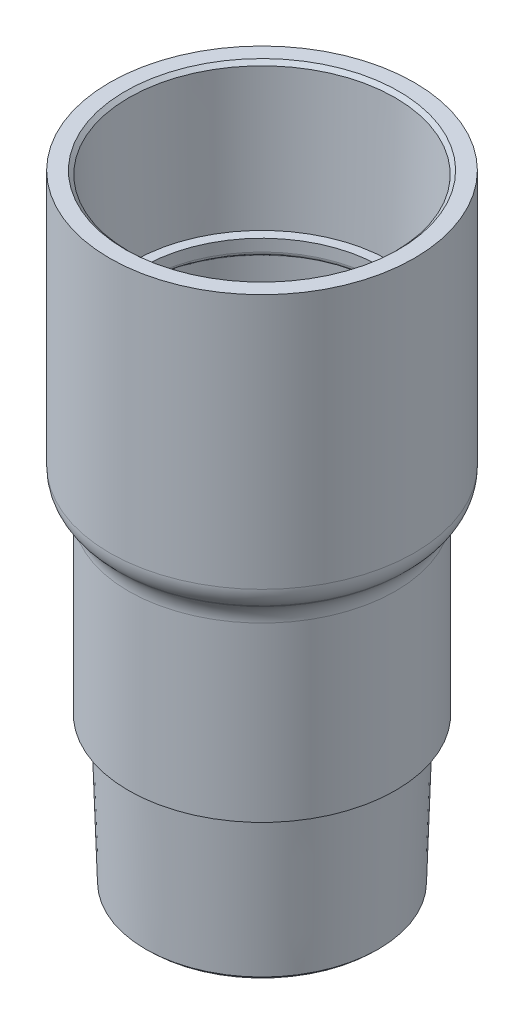
from build123d import *
from OCP.BRepFilletAPI import BRepFilletAPI_MakeChamfer

# Parameters (mm, degrees)
SKETCH5_R                = 1.5875
FUEL_INLET_DEPTH         = 10.8458
FUEL_INLET_PATTERN_COUNT = 4
THREAD_PREP_SIZE         = 0.47625
THREAD_PREP_SIZE2        = 0.491858276
OUTSIDE_PREP_ROUND_SIZE  = 2.54
OUTER_ROUND_R            = 3.81
INSIDE_ROUND_R           = 8.89
STEP_ROUND_R             = 0.127
GROOVE_ROUNDS_R          = 0.635
EXIT_ROUND_R             = 0.8255


# Some blends are built 0.0001 mm under size
with BuildPart() as part:
    # Sketch3 → Revolve1 (revolve)
    with BuildSketch(Plane.XY, mode=Mode.PRIVATE) as revolve1_sk:
        Polygon((15.4305, 23.77936473), (15.4305, 41.275), (15.875, 41.275), (15.875, 47.3075), (17.145, 47.3075), (17.145, 61.2775), (15.875, 61.2775), (15.875, 63.5), (17.145, 63.5), (17.740508655, 82.55), (20.280508655, 82.55), (20.280508655, 44.45), (17.78, 44.45), (17.78, 19.922669741), (16.327633655, 19.05), (16.073633655, 19.05), (15.478125, 0), (12.7, 0), (12.7, 19.05), align=None)
    revolve(revolve1_sk.sketch.rotate(Axis((0, 0, 0), (0, 1, 0)), 90), axis=Axis((0, 0, 0), (0, 1, 0)))

    # Sketch5 → Fuel-Inlet (cut)
    with BuildSketch(Plane.XY):
        with Locations((-12.065, 38.4175)):
            Circle(SKETCH5_R)
    fuel_inlet = extrude(amount=-FUEL_INLET_DEPTH, mode=Mode.SUBTRACT)

    # Fuel-Inlet_Pattern: Fuel-Inlet ×4 about axis
    fuel_inlet_pattern_axis = Axis((0, 0, 0), (0, 1, 0))
    for i in range(1, FUEL_INLET_PATTERN_COUNT):
        add(fuel_inlet.rotate(fuel_inlet_pattern_axis, i * 360 / FUEL_INLET_PATTERN_COUNT), mode=Mode.SUBTRACT)

    # Thread_Prep: one chamfer whose edges measure the first distance from different faces: ONE call of the kernel's chamfer builder (chamfer() names one face for all edges)
    thread_prep_edges_1 = [part.edges().sort_by_distance(p)[0] for p in [
        (0, 0, 15.478125),
    ]]
    thread_prep_side_1 = [part.faces().sort_by_distance(p)[0] for p in [
        (0, 9.525, 15.775879328),
    ]]
    thread_prep_edges_2 = [part.edges().sort_by_distance(p)[0] for p in [
        (0, 82.55, 17.740508655),
    ]]
    thread_prep_side_2 = [part.faces().sort_by_distance(p)[0] for p in [
        (0, 73.025, 17.442754328),
    ]]
    thread_prep = BRepFilletAPI_MakeChamfer(part.part.solid().wrapped)
    for e in thread_prep_edges_1:
        thread_prep.Add(THREAD_PREP_SIZE, THREAD_PREP_SIZE2, e.wrapped, thread_prep_side_1[0].wrapped)  # the first distance lies on this face
    for e in thread_prep_edges_2:
        thread_prep.Add(THREAD_PREP_SIZE, THREAD_PREP_SIZE2, e.wrapped, thread_prep_side_2[0].wrapped)  # the first distance lies on this face
    add(Compound.cast(thread_prep.Shape()), mode=Mode.REPLACE)

    # Outside Prep Round
    # the kernel refuses this chamfer: 2.54 mm, written as the material it takes off along each edge
    with BuildSketch(Plane(origin=(0, 44.45, 0), x_dir=(0, 0, -1), z_dir=(1, 0, 0))) as outside_prep_round_piece_1_section:
        Polygon((20.280508655 - OUTSIDE_PREP_ROUND_SIZE, 0), (20.280508655, OUTSIDE_PREP_ROUND_SIZE), (20.280508655, 0), align=None)
    outside_prep_round_piece_1 = revolve(axis=Axis((0, 44.45, 0), (0, 1, 0)), mode=Mode.PRIVATE)
    outside_prep_round_piece_1 = outside_prep_round_piece_1 - Plane(origin=(0, 45.722196626, 0), x_dir=(0, 0, -1), z_dir=(0, -1, 0)) * Cylinder(17.78, 82, mode=Mode.PRIVATE)
    add(outside_prep_round_piece_1, mode=Mode.SUBTRACT)

    # Outer Round
    outer_round_edges = [part.edges().sort_by_distance(p)[0] for p in [
        (0, 46.99, 20.280508655),
        (0, 44.489491345, 17.78),
    ]]
    fillet(outer_round_edges, radius=OUTER_ROUND_R)

    # Inside Round
    inside_round_edges = [part.edges().sort_by_distance(p)[0] for p in [
        (0, 23.77936473, 15.4305),
        (0, 19.05, 12.7),
    ]]
    fillet(inside_round_edges, radius=INSIDE_ROUND_R)

    # Step Round
    step_round_edges = [part.edges().sort_by_distance(p)[0] for p in [
        (0, 41.275, 15.875),
    ]]
    fillet(step_round_edges, radius=STEP_ROUND_R)

    # Groove Rounds
    groove_rounds_edges = [part.edges().sort_by_distance(p)[0] for p in [
        (0, 61.2775, 15.875),
        (0, 61.2775, 17.145),
        (0, 47.3075, 17.145),
        (0, 47.3075, 15.875),
    ]]
    fillet(groove_rounds_edges, radius=GROOVE_ROUNDS_R - 0.0001)  # a hair under: the kernel refuses the full size

    # Exit Round
    exit_round_edges = [part.edges().sort_by_distance(p)[0] for p in [
        (0, 0, 12.7),
    ]]
    fillet(exit_round_edges, radius=EXIT_ROUND_R)


solid = part.part
